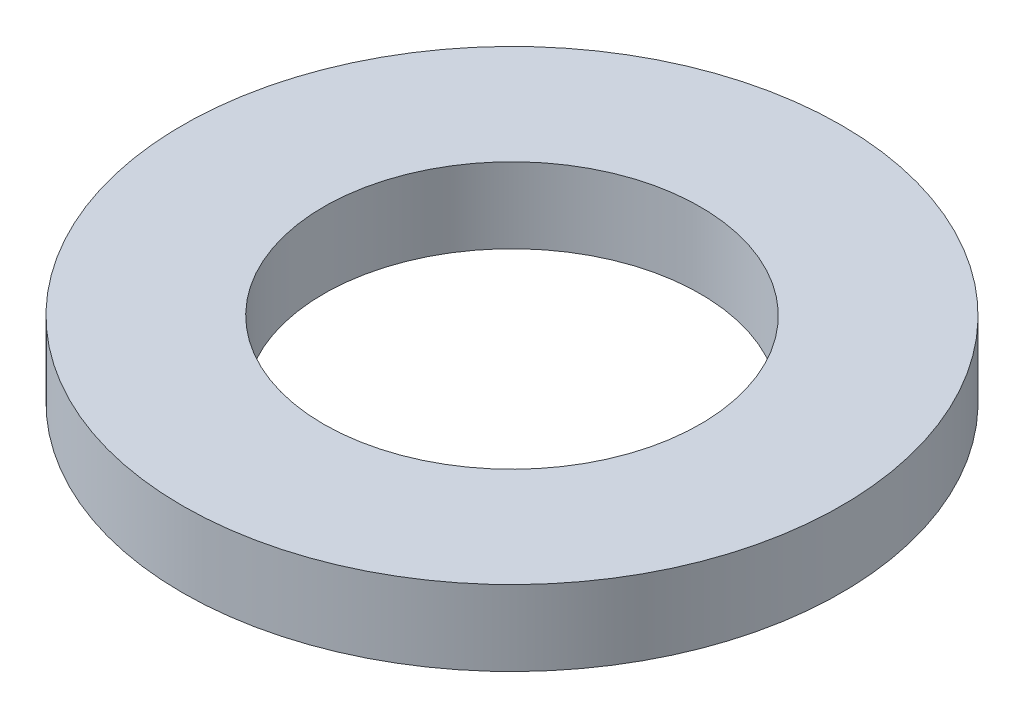
from build123d import *

# Parameters (mm, degrees)
SKETCH1_R           = 17.5
BOSS_EXTRUDE1_DEPTH = 4
SKETCH2_R           = 10
CUT_EXTRUDE1_DEPTH  = 26.069902273


with BuildPart() as part:
    # Sketch1 → Boss-Extrude1 (new body)
    with BuildSketch(Plane(origin=(0, 0, 0), x_dir=(1, 0, 0), z_dir=(0, 1, 0))):
        Circle(SKETCH1_R)
    extrude(amount=BOSS_EXTRUDE1_DEPTH)

    # Sketch2 → Cut-Extrude1 (cut, through all)
    with BuildSketch(Plane(origin=(0, 0, 0), x_dir=(1, 0, 0), z_dir=(0, 1, 0))):
        Circle(SKETCH2_R)
    extrude(amount=CUT_EXTRUDE1_DEPTH, mode=Mode.SUBTRACT)


solid = part.part
